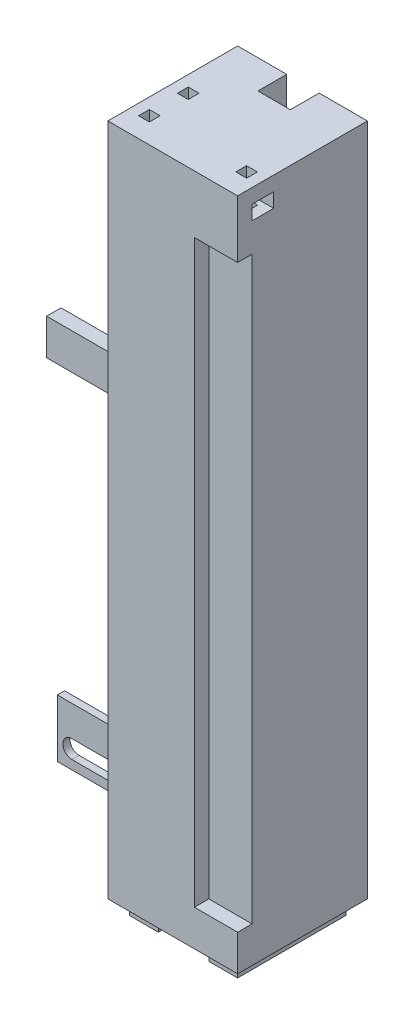
from build123d import *

# Parameters (mm, degrees)
SKETCH1_W           = 36
SKETCH1_H           = 36
BOSS_EXTRUDE1_DEPTH = 186.9
BOSS_EXTRUDE2_DEPTH = 4
SKETCH3_R           = 2
CUT_EXTRUDE1_DEPTH  = 5
SKETCH4_W           = 9
SKETCH4_H           = 186.9
CUT_EXTRUDE2_DEPTH  = 8
SKETCH5_W           = 6
SKETCH5_H           = 4
CUT_EXTRUDE3_DEPTH  = 9
SKETCH6_W           = 3
SKETCH6_H           = 3
CUT_EXTRUDE4_DEPTH  = 10
SKETCH7_W           = 2
SKETCH7_H           = 16
BOSS_EXTRUDE3_DEPTH = 40
CUT_EXTRUDE5_REACH  = 194.893
SKETCH9_W           = 4
SKETCH9_H           = 10
BOSS_EXTRUDE4_DEPTH = 45
CHAMFER1_SIZE       = 20
CUT_EXTRUDE6_DEPTH  = 27
SKETCH11_W          = 6
SKETCH11_H          = 4
SKETCH11_H_2        = 6
CUT_EXTRUDE7_DEPTH  = 9
SKETCH12_W          = 3
SKETCH12_H          = 3
CUT_EXTRUDE8_DEPTH  = 10
SKETCH13_W          = 12
SKETCH13_H          = 160.9
CUT_EXTRUDE9_DEPTH  = 4


with BuildPart() as part:
    # Sketch1 → Boss-Extrude1 (new body)
    with BuildSketch(Plane(origin=(0, 0, 0), x_dir=(1, 0, 0), z_dir=(0, 1, 0))):
        with Locations((18, 18)):
            Rectangle(SKETCH1_W, SKETCH1_H)
    extrude(amount=BOSS_EXTRUDE1_DEPTH)

    # Sketch2 → Boss-Extrude2 (add)
    with BuildSketch(Plane.XZ):
        Polygon((3, -3), (7, -3), (11, -3), (11, -11), (7, -11), (7, -25), (11, -25), (11, -33), (7, -33), (3, -33), align=None)
        Polygon((29, -3), (33, -3), (33, -33), (29, -33), (25, -33), (25, -25), (29, -25), (29, -11), (25, -11), (25, -3), align=None)
    extrude(amount=BOSS_EXTRUDE2_DEPTH)

    # Sketch3 → Cut-Extrude1 (cut)
    with BuildSketch(Plane.XZ):
        with Locations((18, -18)):
            Circle(SKETCH3_R)
    extrude(amount=-CUT_EXTRUDE1_DEPTH, mode=Mode.SUBTRACT)

    # Sketch4 → Cut-Extrude2 (cut)
    with BuildSketch(Plane.XY.offset(-36)):
        with Locations((18.12, 93.45)):
            Rectangle(SKETCH4_W, SKETCH4_H)
    extrude(amount=CUT_EXTRUDE2_DEPTH, mode=Mode.SUBTRACT)

    # Sketch5 → Cut-Extrude3 (cut)
    with BuildSketch(Plane(origin=(36, 0, 0), x_dir=(0, 0, -1), z_dir=(1, 0, 0))):
        with Locations((7, 180.9)):
            Rectangle(SKETCH5_W, SKETCH5_H)
    extrude(amount=-CUT_EXTRUDE3_DEPTH, mode=Mode.SUBTRACT)

    # Sketch6 → Cut-Extrude4 (cut)
    with BuildSketch(Plane(origin=(0, 186.9, 0), x_dir=(1, 0, 0), z_dir=(0, 1, 0))):
        with Locations((31.5, 7)):
            Rectangle(SKETCH6_W, SKETCH6_H)
    extrude(amount=-CUT_EXTRUDE4_DEPTH, mode=Mode.SUBTRACT)

    # Sketch7 → Boss-Extrude3 (add)
    with BuildSketch(Plane.ZY):
        with Locations((-27, 8)):
            Rectangle(SKETCH7_W, SKETCH7_H)
    extrude(amount=BOSS_EXTRUDE3_DEPTH)

    # Sketch8 → Cut-Extrude5 (cut, up to next)
    with BuildSketch(Plane.XY.offset(-26), mode=Mode.PRIVATE) as cut_extrude5_sk1:
        with BuildLine():
            Line((-36, 7.5), (-12, 7.5))
            ThreePointArc((-12, 7.5), (-9.5, 5), (-12, 2.5))
            Line((-12, 2.5), (-36, 2.5))
            ThreePointArc((-36, 2.5), (-38.5, 5), (-36, 7.5))
        make_face()
    cut_extrude5_tool1 = extrude(cut_extrude5_sk1.sketch, amount=-CUT_EXTRUDE5_REACH, mode=Mode.PRIVATE) & part.part
    add(cut_extrude5_tool1.solids().sort_by_distance((-24, 5, -26))[0], mode=Mode.SUBTRACT)

    # Sketch9 → Boss-Extrude4 (add)
    with BuildSketch(Plane.ZY):
        with Locations((-30, 98.5)):
            Rectangle(SKETCH9_W, SKETCH9_H)
    extrude(amount=BOSS_EXTRUDE4_DEPTH)

    # Chamfer1
    chamfer1_edges = [part.edges().sort_by_distance(p)[0] for p in [
        (0, 93.5, -30),
        (0, 16, -27),
    ]]
    chamfer(chamfer1_edges, length=CHAMFER1_SIZE)

    # Sketch10 → Cut-Extrude6 (cut)
    with BuildSketch(Plane.XY.offset(-26)):
        Polygon((-17.171572875, 93.5), (-2, 78.328427125), (-2, 93.5), align=None)
        Polygon((-17.171572875, 16), (-2, 31.171572875), (-2, 16), align=None)
    extrude(amount=-CUT_EXTRUDE6_DEPTH, mode=Mode.SUBTRACT)

    # Sketch11 → Cut-Extrude7 (cut)
    with BuildSketch(Plane.ZY):
        with Locations((-7, 180.9)):
            Rectangle(SKETCH11_W, SKETCH11_H)
        with Locations((-17.8, 180.9)):
            Rectangle(SKETCH11_W, SKETCH11_H)
        with Locations((-13, 169.9)):
            Rectangle(SKETCH11_W, SKETCH11_H_2)
    extrude(amount=-CUT_EXTRUDE7_DEPTH, mode=Mode.SUBTRACT)

    # Sketch12 → Cut-Extrude8 (cut)
    with BuildSketch(Plane(origin=(0, 186.9, 0), x_dir=(1, 0, 0), z_dir=(0, 1, 0))):
        with Locations((4.5, 7)):
            Rectangle(SKETCH12_W, SKETCH12_H)
        with Locations((4.5, 17.8)):
            Rectangle(SKETCH12_W, SKETCH12_H)
    extrude(amount=-CUT_EXTRUDE8_DEPTH, mode=Mode.SUBTRACT)

    # Sketch13 → Cut-Extrude9 (cut)
    with BuildSketch(Plane.XY):
        with Locations((30, 90.45)):
            Rectangle(SKETCH13_W, SKETCH13_H)
    extrude(amount=-CUT_EXTRUDE9_DEPTH, mode=Mode.SUBTRACT)


solid = part.part
